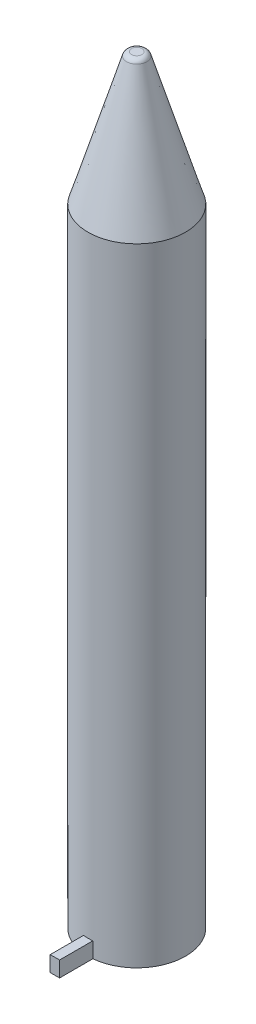
from build123d import *

# Parameters (mm, degrees)
SKETCH1_R           = 9.398
BOSS_EXTRUDE1_DEPTH = 120.65
BOSS_EXTRUDE2_DEPTH = 3


with BuildPart() as part:
    # Sketch1 → Boss-Extrude1 (new body)
    with BuildSketch(Plane(origin=(0, 0, 0), x_dir=(1, 0, 0), z_dir=(0, 1, 0))):
        Circle(SKETCH1_R)
    extrude(amount=BOSS_EXTRUDE1_DEPTH)

    # Sketch2 → Revolve1 (revolve)
    with BuildSketch(Plane.XY):
        with BuildLine():
            Line((0, 120.65), (0, 146.05))
            Line((0, 146.05), (1, 146.05))
            ThreePointArc((1, 146.05), (1.59642422, 145.85266939), (1.95746293, 145.338556299))
            Line((1.95746293, 145.338556299), (9.398, 120.65))
            Line((9.398, 120.65), (0, 120.65))
        make_face()
    revolve(axis=Axis((0, 120.65, 0), (0, 1, 0)))

    # Sketch3 → Boss-Extrude2 (add)
    with BuildSketch(Plane.XZ):
        with BuildLine():
            Line((-0.9, 15.75), (0.9, 15.75))
            Line((0.9, 15.75), (0.9, 9.354806465))
            ThreePointArc((0.9, 9.354806465), (0, 9.398), (-0.9, 9.354806465))
            Line((-0.9, 9.354806465), (-0.9, 15.75))
        make_face()
    extrude(amount=-BOSS_EXTRUDE2_DEPTH)


solid = part.part
